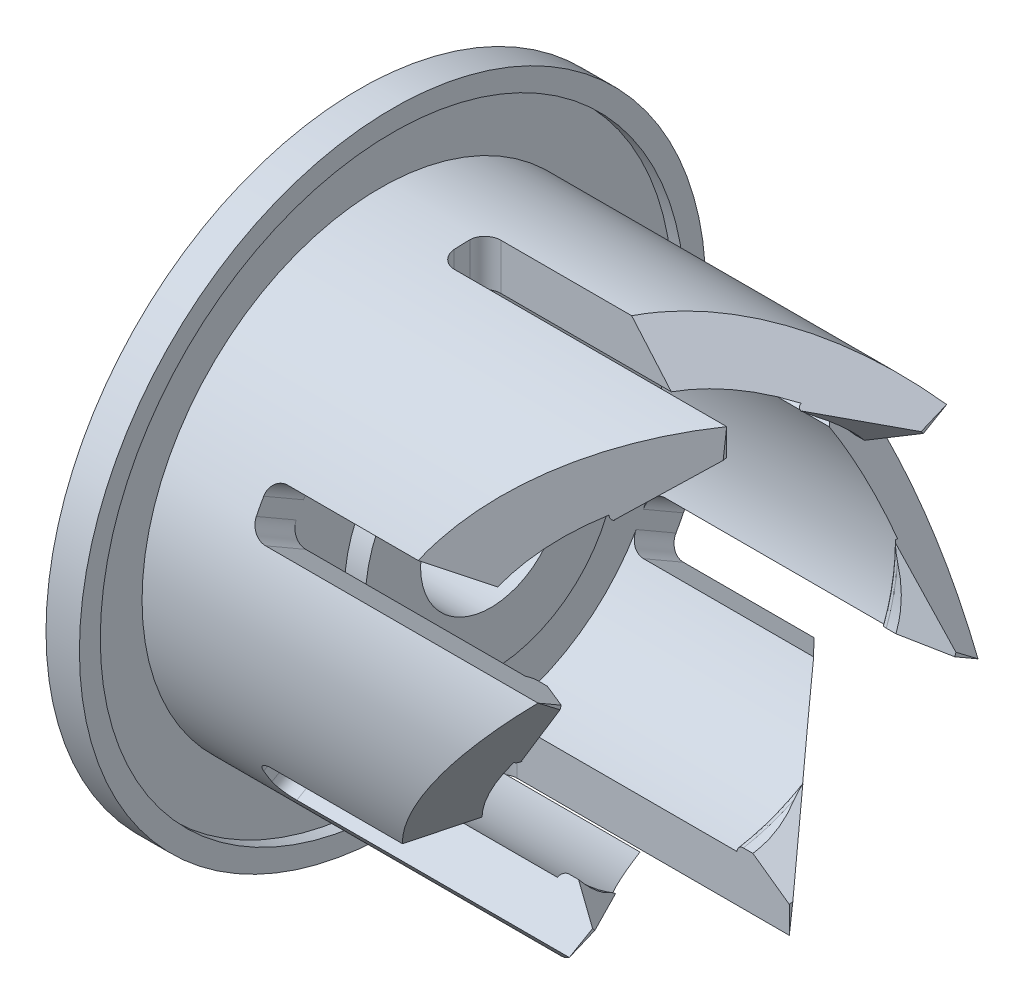
from build123d import *

# Parameters (mm, degrees)
P_IDAT_START               = 13.8
P_IDAT_VYSUNUT_M1_DEPTH    = 13.8
P_IDAT_START_2             = 2.5
P_IDAT_VYSUNUT_M2_DEPTH    = 2.5
ODEBRAT_VYSUNUT_M1_REACH   = 35.645
SKICA5_W                   = 8.590543223
SKICA5_H                   = 8.778346086
ZAOBLIT3_R                 = 0.3
ZAOBLIT2_R                 = 0.75
ODEBRAT_VYSUNUT_M2_DEPTH   = 1
KRUHOV_POLE1_COUNT         = 6
ZAOBLIT3_OF_KRUHOV_POLE1_R = 0.3
ZAOBLIT2_OF_KRUHOV_POLE1_R = 0.75


# Some blends are built 0.0001 mm under size
with BuildPart() as part:
    # Skica1 → Rotovat1 (revolve)
    with BuildSketch(Plane.XY, mode=Mode.PRIVATE) as rotovat1_sk:
        Polygon((0, 3.36), (0, 15), (1.6, 15), (1.6, 14), (1, 14), (1, 11.4), (5.3, 11.4), (5.3, 6), (6.3, 6), (6.3, 3.36), align=None)
    revolve(rotovat1_sk.sketch.rotate(Axis((-2.606955959, 0, 0), (1, 0, 0)), 90), axis=Axis((-2.606955959, 0, 0), (1, 0, 0)))

    # Skica2 → Přidat vysunutím1 (add)
    with BuildSketch(Plane(origin=(5.3, 0, 0), x_dir=(0, 0, -1), z_dir=(1, 0, 0)).offset(P_IDAT_START)):
        with BuildLine():
            Line((7.110820568, 5.837484977), (9.036853427, 6.949480566))
            ThreePointArc((9.036853427, 6.949480566), (5.370530632, 10.055714829), (0.75, 11.375302194))
            Line((0.75, 11.375302194), (0.75, 9.169378387))
            ThreePointArc((0.75, 9.169378387), (4.268899557, 8.149631683), (7.110820568, 5.837484977))
        make_face()
    p_idat_vysunut_m1 = extrude(amount=-P_IDAT_VYSUNUT_M1_DEPTH)

    # Skica7 → Přidat vysunutím2 (add)
    with BuildSketch(Plane(origin=(16.6, 0, 0), x_dir=(0, 0, -1), z_dir=(1, 0, 0)).offset(P_IDAT_START_2)):
        with BuildLine():
            Line((7.110820568, 5.837484977), (6.847367965, 5.685380546))
            ThreePointArc((6.847367965, 5.685380546), (4.118593427, 7.889688725), (0.75, 8.868342573))
            Line((0.75, 8.868342573), (0.75, 9.169378387))
            ThreePointArc((0.75, 9.169378387), (4.268899557, 8.149631683), (7.110820568, 5.837484977))
        make_face()
    p_idat_vysunut_m2 = extrude(amount=-P_IDAT_VYSUNUT_M2_DEPTH)

    # Skica5 → Odebrat vysunutím1 (cut, up to next)
    with BuildSketch(Plane(origin=(11.660666722, 10.043532193, 4.204448892), x_dir=(0.19968234892823142, 0.17198983108972582, -0.9646483595218683), z_dir=(0.7309059645662161, 0.6295418401423061, 0.2635404000751467)), mode=Mode.PRIVATE) as odebrat_vysunut_m1_sk1:
        with Locations((9.431287076, -3.797339156)):
            Rectangle(SKICA5_W, SKICA5_H)
    odebrat_vysunut_m1_tool1 = extrude(odebrat_vysunut_m1_sk1.sketch, amount=ODEBRAT_VYSUNUT_M1_REACH, mode=Mode.PRIVATE) & part.part
    odebrat_vysunut_m1 = odebrat_vysunut_m1_tool1.solids().sort_by_distance((16.02212, 8.788406, -4.893427))[0]
    add(odebrat_vysunut_m1, mode=Mode.SUBTRACT)

    # Zaoblit3
    zaoblit3_edges = [part.edges().sort_by_distance(p)[0] for p in [
        (16.6, 6.886968421, -5.637345649),
    ]]
    fillet(zaoblit3_edges, radius=ZAOBLIT3_R - 0.0001)  # a hair under: the kernel refuses the full size

    # Zaoblit2
    # the kernel refuses this fillet: 0.75 mm, written as the material it adds along each edge
    with BuildSketch(Plane(origin=(5.3, 13.250302194, -0.75), x_dir=(0, 0, 1), z_dir=(0, -1, 0))) as zaoblit2_piece_1_section:
        with BuildLine():
            CenterArc((ZAOBLIT2_R, -ZAOBLIT2_R), ZAOBLIT2_R, 90, 90)
            Line((0, -ZAOBLIT2_R), (0, 0))
            Line((0, 0), (ZAOBLIT2_R, 0))
        make_face()
    zaoblit2_piece_1 = extrude(amount=5.955923807, mode=Mode.PRIVATE)
    zaoblit2_piece_1 = zaoblit2_piece_1 & Plane(origin=(5.46987452, 0, 0), x_dir=(0, 0, 1), z_dir=(1, 0, 0)) * Cylinder(11.4, 15, mode=Mode.PRIVATE)
    zaoblit2_piece_1 = zaoblit2_piece_1 - Plane(origin=(5.46987452, 0, 0), x_dir=(0, 0.996671563780742, -0.08152173913043399), z_dir=(1, 0, 0)) * Cylinder(9.2, 15, mode=Mode.PRIVATE)
    add(zaoblit2_piece_1)
    with BuildSketch(Plane(origin=(5.3, 4.899984977, -5.487022936), x_dir=(1, 0, 0), z_dir=(0, 0.4999999999999978, -0.86602540378444))) as zaoblit2_piece_2_section:
        with BuildLine():
            CenterArc((ZAOBLIT2_R, ZAOBLIT2_R), ZAOBLIT2_R, 180, 90)
            Line((0, ZAOBLIT2_R), (0, 0))
            Line((0, 0), (ZAOBLIT2_R, 0))
        make_face()
    zaoblit2_piece_2 = extrude(amount=5.973991179, mode=Mode.PRIVATE)
    zaoblit2_piece_2 = zaoblit2_piece_2 & Plane(origin=(5.469987855, 0, 0), x_dir=(0, 0, 1), z_dir=(1, 0, 0)) * Cylinder(11.4, 15, mode=Mode.PRIVATE)
    zaoblit2_piece_2 = zaoblit2_piece_2 - Plane(origin=(5.469987855, 0, 0), x_dir=(0, 0.996671563780742, -0.08152173913043399), z_dir=(1, 0, 0)) * Cylinder(9.2, 15, mode=Mode.PRIVATE)
    add(zaoblit2_piece_2)

    # Skica9 → Odebrat vysunutím2 (cut)
    with BuildSketch(Plane(origin=(2.102825924, -1.961858089, 2.273763983), x_dir=(0, 0.7571271892036343, 0.6532674944986963), z_dir=(-0.5735764363510502, 0.5351254035861529, -0.6202022848229333))):
        Polygon((1.357664292, 25.111652157), (-6.106914967, 20.399180109), (-3.864124611, 14.929480306), (5.953176513, 20.129937089), align=None)
    odebrat_vysunut_m2 = extrude(amount=ODEBRAT_VYSUNUT_M2_DEPTH, mode=Mode.SUBTRACT)

    # Kruhové pole1: Přidat vysunutím1, Přidat vysunutím2, Odebrat vysunutím1, Odebrat vysunutím2 ×6 about axis
    kruhov_pole1_axis = Axis((0, 0, 0), (1, 0, 0))
    add([p_idat_vysunut_m1.rotate(kruhov_pole1_axis, i * 360 / KRUHOV_POLE1_COUNT) for i in range(1, KRUHOV_POLE1_COUNT)])
    add([p_idat_vysunut_m2.rotate(kruhov_pole1_axis, i * 360 / KRUHOV_POLE1_COUNT) for i in range(1, KRUHOV_POLE1_COUNT)])
    add([odebrat_vysunut_m1.rotate(kruhov_pole1_axis, i * 360 / KRUHOV_POLE1_COUNT) for i in range(1, KRUHOV_POLE1_COUNT)], mode=Mode.SUBTRACT)
    add([odebrat_vysunut_m2.rotate(kruhov_pole1_axis, i * 360 / KRUHOV_POLE1_COUNT) for i in range(1, KRUHOV_POLE1_COUNT)], mode=Mode.SUBTRACT)

    # Zaoblit3 of Kruhové pole1
    zaoblit3_of_kruhov_pole1_edges = [part.edges().sort_by_distance(p)[0] for p in [
        (16.6, 8.325568753, 3.145616783),
        (16.6, 1.438600332, 8.782962432),
        (16.6, -6.886968421, 5.637345649),
        (16.6, -8.325568753, -3.145616783),
        (16.6, -1.438600332, -8.782962432),
    ]]
    fillet(zaoblit3_of_kruhov_pole1_edges, radius=ZAOBLIT3_OF_KRUHOV_POLE1_R - 0.0001)  # a hair under: the kernel refuses the full size

    # Zaoblit2 of Kruhové pole1
    # the kernel refuses this fillet: 0.75 mm, written as the material it adds along each edge
    with BuildSketch(Plane(origin=(5.3, 7.27467015, 11.100098308), x_dir=(0, -0.8660254037844387, 0.5), z_dir=(0, -0.5, -0.8660254037844387))) as zaoblit2_of_kruhov_pole1_piece_1_section:
        with BuildLine():
            CenterArc((ZAOBLIT2_OF_KRUHOV_POLE1_R, -ZAOBLIT2_OF_KRUHOV_POLE1_R), ZAOBLIT2_OF_KRUHOV_POLE1_R, 90, 90)
            Line((0, -ZAOBLIT2_OF_KRUHOV_POLE1_R), (0, 0))
            Line((0, 0), (ZAOBLIT2_OF_KRUHOV_POLE1_R, 0))
        make_face()
    zaoblit2_of_kruhov_pole1_piece_1 = extrude(amount=5.955923807, mode=Mode.PRIVATE)
    zaoblit2_of_kruhov_pole1_piece_1 = zaoblit2_of_kruhov_pole1_piece_1 & Plane(origin=(5.46987452, 0, 0), x_dir=(0, 0, 1), z_dir=(1, 0, 0)) * Cylinder(11.4, 15, mode=Mode.PRIVATE)
    zaoblit2_of_kruhov_pole1_piece_1 = zaoblit2_of_kruhov_pole1_piece_1 - Plane(origin=(5.46987452, 0, 0), x_dir=(0, 0.5689356789380149, 0.8223820238984679), z_dir=(1, 0, 0)) * Cylinder(9.2, 15, mode=Mode.PRIVATE)
    add(zaoblit2_of_kruhov_pole1_piece_1)
    with BuildSketch(Plane(origin=(5.3, 7.201893742, 1.5), x_dir=(0, 0, -1), z_dir=(0, 1, 0))) as zaoblit2_of_kruhov_pole1_piece_2_section:
        with BuildLine():
            CenterArc((ZAOBLIT2_OF_KRUHOV_POLE1_R, -ZAOBLIT2_OF_KRUHOV_POLE1_R), ZAOBLIT2_OF_KRUHOV_POLE1_R, 90, 90)
            Line((0, -ZAOBLIT2_OF_KRUHOV_POLE1_R), (0, 0))
            Line((0, 0), (ZAOBLIT2_OF_KRUHOV_POLE1_R, 0))
        make_face()
    zaoblit2_of_kruhov_pole1_piece_2 = extrude(amount=5.973991179, mode=Mode.PRIVATE)
    zaoblit2_of_kruhov_pole1_piece_2 = zaoblit2_of_kruhov_pole1_piece_2 & Plane(origin=(5.469987805, 0, 0), x_dir=(0, 0, 1), z_dir=(1, 0, 0)) * Cylinder(11.4, 15, mode=Mode.PRIVATE)
    zaoblit2_of_kruhov_pole1_piece_2 = zaoblit2_of_kruhov_pole1_piece_2 - Plane(origin=(5.469987805, 0, 0), x_dir=(0, 0.5689356789380149, 0.8223820238984679), z_dir=(1, 0, 0)) * Cylinder(9.2, 15, mode=Mode.PRIVATE)
    add(zaoblit2_of_kruhov_pole1_piece_2)
    with BuildSketch(Plane(origin=(5.3, -5.975632044, 11.850098308), x_dir=(0, -0.8660254037844387, -0.49999999999999994), z_dir=(0, 0.49999999999999994, -0.8660254037844387))) as zaoblit2_of_kruhov_pole1_piece_3_section:
        with BuildLine():
            CenterArc((ZAOBLIT2_OF_KRUHOV_POLE1_R, -ZAOBLIT2_OF_KRUHOV_POLE1_R), ZAOBLIT2_OF_KRUHOV_POLE1_R, 90, 90)
            Line((0, -ZAOBLIT2_OF_KRUHOV_POLE1_R), (0, 0))
            Line((0, 0), (ZAOBLIT2_OF_KRUHOV_POLE1_R, 0))
        make_face()
    zaoblit2_of_kruhov_pole1_piece_3 = extrude(amount=5.955923807, mode=Mode.PRIVATE)
    zaoblit2_of_kruhov_pole1_piece_3 = zaoblit2_of_kruhov_pole1_piece_3 & Plane(origin=(5.46987452, 0, 0), x_dir=(0, 0, 1), z_dir=(1, 0, 0)) * Cylinder(11.4, 15, mode=Mode.PRIVATE)
    zaoblit2_of_kruhov_pole1_piece_3 = zaoblit2_of_kruhov_pole1_piece_3 - Plane(origin=(5.46987452, 0, 0), x_dir=(0, -0.427735884842727, 0.9039037630289021), z_dir=(1, 0, 0)) * Cylinder(9.2, 15, mode=Mode.PRIVATE)
    add(zaoblit2_of_kruhov_pole1_piece_3)
    with BuildSketch(Plane(origin=(5.3, 2.301908765, 6.987022936), x_dir=(0, 0.8660254037844373, -0.5000000000000026), z_dir=(0, 0.5000000000000026, 0.8660254037844373))) as zaoblit2_of_kruhov_pole1_piece_4_section:
        with BuildLine():
            CenterArc((ZAOBLIT2_OF_KRUHOV_POLE1_R, -ZAOBLIT2_OF_KRUHOV_POLE1_R), ZAOBLIT2_OF_KRUHOV_POLE1_R, 90, 90)
            Line((0, -ZAOBLIT2_OF_KRUHOV_POLE1_R), (0, 0))
            Line((0, 0), (ZAOBLIT2_OF_KRUHOV_POLE1_R, 0))
        make_face()
    zaoblit2_of_kruhov_pole1_piece_4 = extrude(amount=5.973991179, mode=Mode.PRIVATE)
    zaoblit2_of_kruhov_pole1_piece_4 = zaoblit2_of_kruhov_pole1_piece_4 & Plane(origin=(5.469987805, 0, 0), x_dir=(0, 0, 1), z_dir=(1, 0, 0)) * Cylinder(11.4, 15, mode=Mode.PRIVATE)
    zaoblit2_of_kruhov_pole1_piece_4 = zaoblit2_of_kruhov_pole1_piece_4 - Plane(origin=(5.469987805, 0, 0), x_dir=(0, -0.427735884842727, 0.9039037630289021), z_dir=(1, 0, 0)) * Cylinder(9.2, 15, mode=Mode.PRIVATE)
    add(zaoblit2_of_kruhov_pole1_piece_4)
    with BuildSketch(Plane(origin=(5.3, -13.250302194, 0.75), x_dir=(0, 0, -1), z_dir=(0, 1, 0))) as zaoblit2_of_kruhov_pole1_piece_5_section:
        with BuildLine():
            CenterArc((ZAOBLIT2_OF_KRUHOV_POLE1_R, -ZAOBLIT2_OF_KRUHOV_POLE1_R), ZAOBLIT2_OF_KRUHOV_POLE1_R, 90, 90)
            Line((0, -ZAOBLIT2_OF_KRUHOV_POLE1_R), (0, 0))
            Line((0, 0), (ZAOBLIT2_OF_KRUHOV_POLE1_R, 0))
        make_face()
    zaoblit2_of_kruhov_pole1_piece_5 = extrude(amount=5.955923807, mode=Mode.PRIVATE)
    zaoblit2_of_kruhov_pole1_piece_5 = zaoblit2_of_kruhov_pole1_piece_5 & Plane(origin=(5.46987452, 0, 0), x_dir=(0, 0, 1), z_dir=(1, 0, 0)) * Cylinder(11.4, 15, mode=Mode.PRIVATE)
    zaoblit2_of_kruhov_pole1_piece_5 = zaoblit2_of_kruhov_pole1_piece_5 - Plane(origin=(5.46987452, 0, 0), x_dir=(0, -0.996671563780742, 0.08152173913043412), z_dir=(1, 0, 0)) * Cylinder(9.2, 15, mode=Mode.PRIVATE)
    add(zaoblit2_of_kruhov_pole1_piece_5)
    with BuildSketch(Plane(origin=(5.3, -4.899984977, 5.487022936), x_dir=(0, 0.8660254037844399, 0.4999999999999976), z_dir=(0, -0.49999999999999767, 0.8660254037844402))) as zaoblit2_of_kruhov_pole1_piece_6_section:
        with BuildLine():
            CenterArc((ZAOBLIT2_OF_KRUHOV_POLE1_R, -ZAOBLIT2_OF_KRUHOV_POLE1_R), ZAOBLIT2_OF_KRUHOV_POLE1_R, 90, 90)
            Line((0, -ZAOBLIT2_OF_KRUHOV_POLE1_R), (0, 0))
            Line((0, 0), (ZAOBLIT2_OF_KRUHOV_POLE1_R, 0))
        make_face()
    zaoblit2_of_kruhov_pole1_piece_6 = extrude(amount=5.973991179, mode=Mode.PRIVATE)
    zaoblit2_of_kruhov_pole1_piece_6 = zaoblit2_of_kruhov_pole1_piece_6 & Plane(origin=(5.469987805, 0, 0), x_dir=(0, 0, 1), z_dir=(1, 0, 0)) * Cylinder(11.4, 15, mode=Mode.PRIVATE)
    zaoblit2_of_kruhov_pole1_piece_6 = zaoblit2_of_kruhov_pole1_piece_6 - Plane(origin=(5.469987805, 0, 0), x_dir=(0, -0.996671563780742, 0.08152173913043412), z_dir=(1, 0, 0)) * Cylinder(9.2, 15, mode=Mode.PRIVATE)
    add(zaoblit2_of_kruhov_pole1_piece_6)
    with BuildSketch(Plane(origin=(5.3, -7.27467015, -11.100098308), x_dir=(0, 0.8660254037844384, -0.5000000000000003), z_dir=(0, 0.5000000000000003, 0.8660254037844385))) as zaoblit2_of_kruhov_pole1_piece_7_section:
        with BuildLine():
            CenterArc((ZAOBLIT2_OF_KRUHOV_POLE1_R, -ZAOBLIT2_OF_KRUHOV_POLE1_R), ZAOBLIT2_OF_KRUHOV_POLE1_R, 90, 90)
            Line((0, -ZAOBLIT2_OF_KRUHOV_POLE1_R), (0, 0))
            Line((0, 0), (ZAOBLIT2_OF_KRUHOV_POLE1_R, 0))
        make_face()
    zaoblit2_of_kruhov_pole1_piece_7 = extrude(amount=5.955923807, mode=Mode.PRIVATE)
    zaoblit2_of_kruhov_pole1_piece_7 = zaoblit2_of_kruhov_pole1_piece_7 & Plane(origin=(5.46987452, 0, 0), x_dir=(0, 0, 1), z_dir=(1, 0, 0)) * Cylinder(11.4, 15, mode=Mode.PRIVATE)
    zaoblit2_of_kruhov_pole1_piece_7 = zaoblit2_of_kruhov_pole1_piece_7 - Plane(origin=(5.46987452, 0, 0), x_dir=(0, -0.5689356789380151, -0.8223820238984676), z_dir=(1, 0, 0)) * Cylinder(9.2, 15, mode=Mode.PRIVATE)
    add(zaoblit2_of_kruhov_pole1_piece_7)
    with BuildSketch(Plane(origin=(5.3, -7.201893742, -1.5), x_dir=(0, 0, 1), z_dir=(0, -1, 0))) as zaoblit2_of_kruhov_pole1_piece_8_section:
        with BuildLine():
            CenterArc((ZAOBLIT2_OF_KRUHOV_POLE1_R, -ZAOBLIT2_OF_KRUHOV_POLE1_R), ZAOBLIT2_OF_KRUHOV_POLE1_R, 90, 90)
            Line((0, -ZAOBLIT2_OF_KRUHOV_POLE1_R), (0, 0))
            Line((0, 0), (ZAOBLIT2_OF_KRUHOV_POLE1_R, 0))
        make_face()
    zaoblit2_of_kruhov_pole1_piece_8 = extrude(amount=5.973991179, mode=Mode.PRIVATE)
    zaoblit2_of_kruhov_pole1_piece_8 = zaoblit2_of_kruhov_pole1_piece_8 & Plane(origin=(5.469987805, 0, 0), x_dir=(0, 0, 1), z_dir=(1, 0, 0)) * Cylinder(11.4, 15, mode=Mode.PRIVATE)
    zaoblit2_of_kruhov_pole1_piece_8 = zaoblit2_of_kruhov_pole1_piece_8 - Plane(origin=(5.469987805, 0, 0), x_dir=(0, -0.5689356789380151, -0.8223820238984676), z_dir=(1, 0, 0)) * Cylinder(9.2, 15, mode=Mode.PRIVATE)
    add(zaoblit2_of_kruhov_pole1_piece_8)
    with BuildSketch(Plane(origin=(5.3, 5.975632044, -11.850098308), x_dir=(1, 0, 0), z_dir=(0, -0.5000000000000003, 0.8660254037844386))) as zaoblit2_of_kruhov_pole1_piece_9_section:
        with BuildLine():
            CenterArc((ZAOBLIT2_OF_KRUHOV_POLE1_R, ZAOBLIT2_OF_KRUHOV_POLE1_R), ZAOBLIT2_OF_KRUHOV_POLE1_R, 180, 90)
            Line((0, ZAOBLIT2_OF_KRUHOV_POLE1_R), (0, 0))
            Line((0, 0), (ZAOBLIT2_OF_KRUHOV_POLE1_R, 0))
        make_face()
    zaoblit2_of_kruhov_pole1_piece_9 = extrude(amount=5.955923807, mode=Mode.PRIVATE)
    zaoblit2_of_kruhov_pole1_piece_9 = zaoblit2_of_kruhov_pole1_piece_9 - Plane(origin=(5.469874541, 0, 0), x_dir=(0, 0.4277358848427273, -0.9039037630289019), z_dir=(1, 0, 0)) * Cylinder(9.2, 15, mode=Mode.PRIVATE)
    zaoblit2_of_kruhov_pole1_piece_9 = zaoblit2_of_kruhov_pole1_piece_9 & Plane(origin=(5.469874541, 0, 0), x_dir=(0, 0, 1), z_dir=(1, 0, 0)) * Cylinder(11.4, 15, mode=Mode.PRIVATE)
    add(zaoblit2_of_kruhov_pole1_piece_9)
    with BuildSketch(Plane(origin=(5.3, -2.301908765, -6.987022936), x_dir=(1, 0, 0), z_dir=(0, -0.5000000000000022, -0.8660254037844375))) as zaoblit2_of_kruhov_pole1_piece_10_section:
        with BuildLine():
            CenterArc((ZAOBLIT2_OF_KRUHOV_POLE1_R, ZAOBLIT2_OF_KRUHOV_POLE1_R), ZAOBLIT2_OF_KRUHOV_POLE1_R, 180, 90)
            Line((0, ZAOBLIT2_OF_KRUHOV_POLE1_R), (0, 0))
            Line((0, 0), (ZAOBLIT2_OF_KRUHOV_POLE1_R, 0))
        make_face()
    zaoblit2_of_kruhov_pole1_piece_10 = extrude(amount=5.973991179, mode=Mode.PRIVATE)
    zaoblit2_of_kruhov_pole1_piece_10 = zaoblit2_of_kruhov_pole1_piece_10 - Plane(origin=(5.469987855, 0, 0), x_dir=(0, 0.4277358848427273, -0.9039037630289019), z_dir=(1, 0, 0)) * Cylinder(9.2, 15, mode=Mode.PRIVATE)
    zaoblit2_of_kruhov_pole1_piece_10 = zaoblit2_of_kruhov_pole1_piece_10 & Plane(origin=(5.469987855, 0, 0), x_dir=(0, 0, 1), z_dir=(1, 0, 0)) * Cylinder(11.4, 15, mode=Mode.PRIVATE)
    add(zaoblit2_of_kruhov_pole1_piece_10)


solid = part.part
